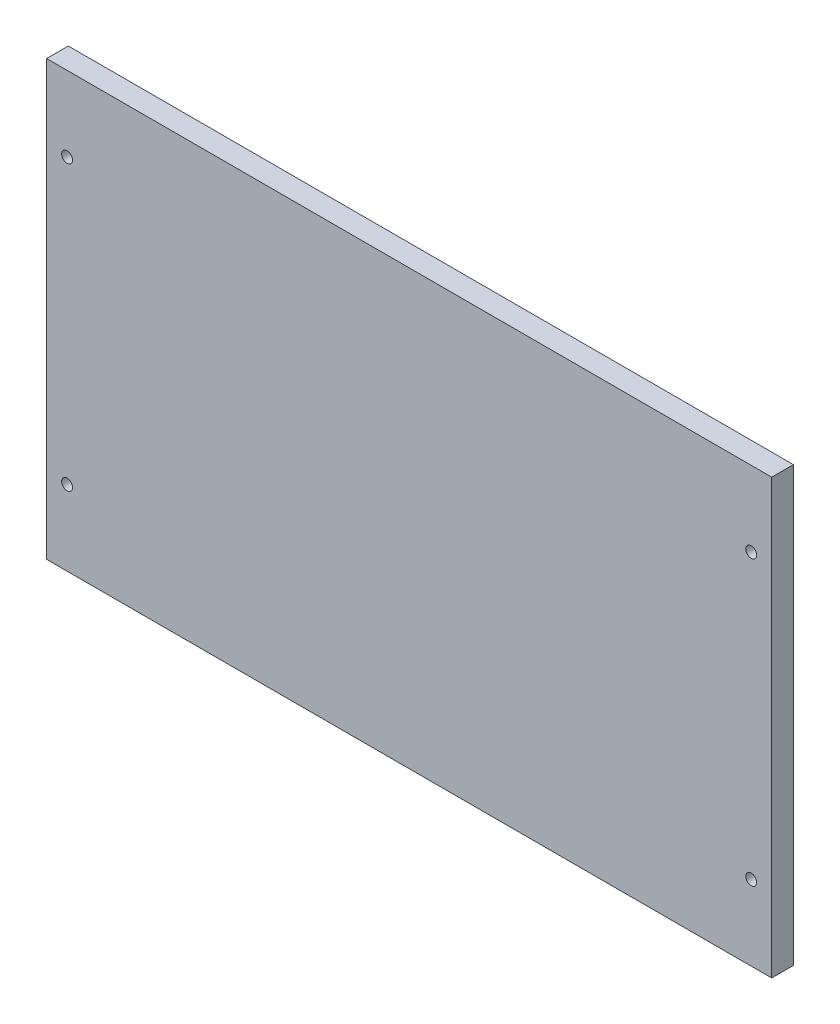
from build123d import *

# Parameters (mm, degrees)
SKETCH1_W  = 212.3
SKETCH1_H  = 127
SKETCH1_R  = 1.6
WALL_DEPTH = 6.35


with BuildPart() as part:
    # Sketch1 → Wall (new body)
    with BuildSketch(Plane.XY):
        with Locations((106.15, 63.5)):
            Rectangle(SKETCH1_W, SKETCH1_H)
        with Locations((6, 105)):
            Circle(SKETCH1_R, mode=Mode.SUBTRACT)
        with Locations((206.3, 105)):
            Circle(SKETCH1_R, mode=Mode.SUBTRACT)
        with Locations((206.3, 22)):
            Circle(SKETCH1_R, mode=Mode.SUBTRACT)
        with Locations((6, 22)):
            Circle(SKETCH1_R, mode=Mode.SUBTRACT)
    extrude(amount=WALL_DEPTH)


solid = part.part
